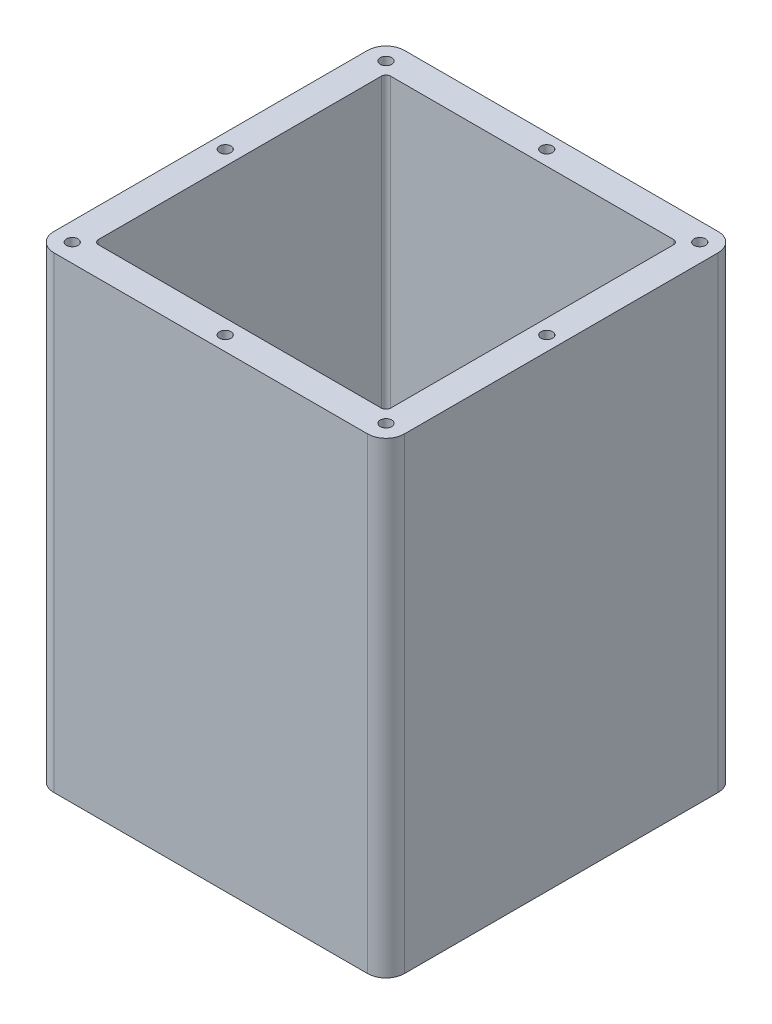
from build123d import *

# Parameters (mm, degrees)
BOSS_EXTRUDE1_DEPTH       = 101.603999992
CUT_EXTRUDE1_DEPTH        = 246.126
SKETCH14_W                = 76.2
SKETCH14_H                = 76.2
SKETCH14_W_2              = 63.5
SKETCH14_H_2              = 63.5
BOSS_EXTRUDE3_DEPTH       = 101.603999992
FILLET1_R                 = 4
M3X0_5_TAPPED_HOLE2_D     = 2.5
M3X0_5_TAPPED_HOLE2_DEPTH = 7.5
M3X0_5_TAPPED_HOLE2_TIP   = 0.751075774
M3X0_5_TAPPED_HOLE1_D     = 2.5
M3X0_5_TAPPED_HOLE1_DEPTH = 7.5
M3X0_5_TAPPED_HOLE1_TIP   = 0.751075774
FILLET2_R                 = 1


with BuildPart() as part:
    # Sketch1 → Boss-Extrude1 (new body)
    with BuildSketch(Plane(origin=(0, 0, 0), x_dir=(1, 0, 0), z_dir=(0, 1, 0))):
        with BuildLine():
            Line((-35.56, -38.1), (35.56, -38.1))
            ThreePointArc((35.56, -38.1), (37.356051224, -37.356051224), (38.1, -35.56))
            Line((38.1, -35.56), (38.1, 35.56))
            ThreePointArc((38.1, 35.56), (37.356051224, 37.356051224), (35.56, 38.1))
            Line((35.56, 38.1), (-35.56, 38.1))
            ThreePointArc((-35.56, 38.1), (-37.356051224, 37.356051224), (-38.1, 35.56))
            Line((-38.1, 35.56), (-38.1, -35.56))
            ThreePointArc((-38.1, -35.56), (-37.356051224, -37.356051224), (-35.56, -38.1))
        make_face()
    extrude(amount=BOSS_EXTRUDE1_DEPTH)

    # Sketch9 → Cut-Extrude1 (cut)
    with BuildSketch(Plane(origin=(0, 101.603999992, 0), x_dir=(1, 0, 0), z_dir=(0, 1, 0))):
        with BuildLine():
            Line((-30.56, -33.1), (30.56, -33.1))
            ThreePointArc((30.56, -33.1), (32.356051224, -32.356051224), (33.1, -30.56))
            Line((33.1, -30.56), (33.1, 30.56))
            ThreePointArc((33.1, 30.56), (32.356051224, 32.356051224), (30.56, 33.1))
            Line((30.56, 33.1), (-30.56, 33.1))
            ThreePointArc((-30.56, 33.1), (-32.356051224, 32.356051224), (-33.1, 30.56))
            Line((-33.1, 30.56), (-33.1, -30.56))
            ThreePointArc((-33.1, -30.56), (-32.356051224, -32.356051224), (-30.56, -33.1))
        make_face()
    extrude(amount=-CUT_EXTRUDE1_DEPTH, mode=Mode.SUBTRACT)

    # Sketch14 → Boss-Extrude3 (add)
    with BuildSketch(Plane(origin=(0, 101.603999992, 0), x_dir=(1, 0, 0), z_dir=(0, 1, 0))):
        Rectangle(SKETCH14_W, SKETCH14_H)
        Rectangle(SKETCH14_W_2, SKETCH14_H_2, mode=Mode.SUBTRACT)
    extrude(amount=-BOSS_EXTRUDE3_DEPTH)

    # Fillet1
    fillet1_edges = [part.edges().sort_by_distance(p)[0] for p in [
        (-38.1, 50.801999996, -38.1),
        (-38.1, 50.801999996, 38.1),
        (38.1, 50.801999996, 38.1),
        (38.1, 50.801999996, -38.1),
    ]]
    fillet(fillet1_edges, radius=FILLET1_R)

    # M3x0.5 Tapped Hole2
    with Locations(Plane(origin=(0, 101.603999992, 0), x_dir=(1, 0, 0), z_dir=(0, 1, 0))):
        with Locations((-34.1, 34.1), (34.1, 34.1), (34.1, -34.100008), (-34.1, -34.100008), (-34.95, 0), (34.94999995, 0), (0, -34.95), (0, 34.95)):
            Hole(M3X0_5_TAPPED_HOLE2_D / 2, depth=M3X0_5_TAPPED_HOLE2_DEPTH)
            with Locations((0, 0, -(M3X0_5_TAPPED_HOLE2_DEPTH + M3X0_5_TAPPED_HOLE2_TIP / 2))):  # 118° drill point
                Cone(0, M3X0_5_TAPPED_HOLE2_D / 2, M3X0_5_TAPPED_HOLE2_TIP, mode=Mode.SUBTRACT)

    # M3x0.5 Tapped Hole1
    with Locations(Plane(origin=(0, 0, 0), x_dir=(-1, 0, 0), z_dir=(0, -1, 0))):
        with Locations((-34.100008, 34.1), (34.1, 34.1), (34.1, -34.1), (-34.100008, -34.1), (-34.95, 0), (0, 34.95), (34.95, 0), (0, -34.94999995)):
            Hole(M3X0_5_TAPPED_HOLE1_D / 2, depth=M3X0_5_TAPPED_HOLE1_DEPTH)
            with Locations((0, 0, -(M3X0_5_TAPPED_HOLE1_DEPTH + M3X0_5_TAPPED_HOLE1_TIP / 2))):  # 118° drill point
                Cone(0, M3X0_5_TAPPED_HOLE1_D / 2, M3X0_5_TAPPED_HOLE1_TIP, mode=Mode.SUBTRACT)

    # Fillet2
    fillet2_edges = [part.edges().sort_by_distance(p)[0] for p in [
        (31.75, 50.801999996, 31.75),
        (-31.75, 50.801999996, 31.75),
        (-31.75, 50.801999996, -31.75),
        (31.75, 50.801999996, -31.75),
    ]]
    fillet(fillet2_edges, radius=FILLET2_R)


solid = part.part
